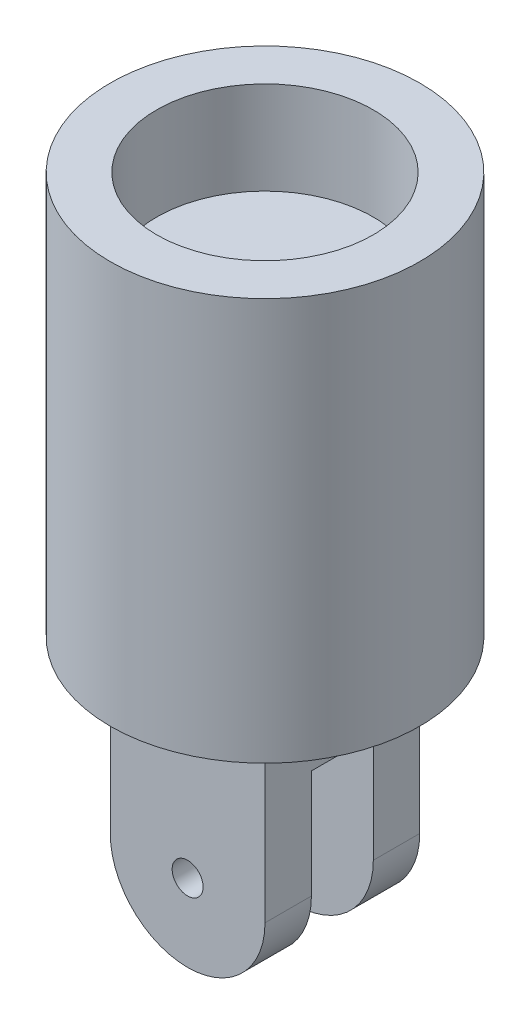
from build123d import *

# Parameters (mm, degrees)
SKETCH1_R           = 5
BOSS_EXTRUDE1_DEPTH = 13
SKETCH2_R           = 3.5
CUT_EXTRUDE1_DEPTH  = 3
SKETCH3_W           = 5
SKETCH3_H           = 5
BOSS_EXTRUDE2_DEPTH = 8
SKETCH4_W           = 5
SKETCH4_H           = 2
CUT_EXTRUDE2_DEPTH  = 6
FILLET2_R           = 2.5
SKETCH5_R           = 0.5
CUT_EXTRUDE4_DEPTH  = 16.81929202


with BuildPart() as part:
    # Sketch1 → Boss-Extrude1 (new body)
    with BuildSketch(Plane(origin=(0, 0, 0), x_dir=(1, 0, 0), z_dir=(0, 1, 0))):
        with Locations(Location((0, 0, 0), (0, 0, 90))):
            Circle(SKETCH1_R)
    extrude(amount=BOSS_EXTRUDE1_DEPTH)

    # Sketch2 → Cut-Extrude1 (cut)
    with BuildSketch(Plane(origin=(0, 13, 0), x_dir=(1, 0, 0), z_dir=(0, 1, 0))):
        with Locations(Location((0, 0, 0), (0, 0, 270))):
            Circle(SKETCH2_R)
    extrude(amount=-CUT_EXTRUDE1_DEPTH, mode=Mode.SUBTRACT)

    # Sketch3 → Boss-Extrude2 (add)
    with BuildSketch(Plane(origin=(0, 0, 0), x_dir=(-1, 0, 0), z_dir=(0, -1, 0))):
        Rectangle(SKETCH3_W, SKETCH3_H)
    extrude(amount=BOSS_EXTRUDE2_DEPTH)

    # Sketch4 → Cut-Extrude2 (cut)
    with BuildSketch(Plane(origin=(0, -8, 0), x_dir=(-1, 0, 0), z_dir=(0, -1, 0))):
        Rectangle(SKETCH4_W, SKETCH4_H)
    extrude(amount=-CUT_EXTRUDE2_DEPTH, mode=Mode.SUBTRACT)

    # Fillet2
    fillet2_edges = [part.edges().sort_by_distance(p)[0] for p in [
        (-2.5, -8, 1.75),
        (2.5, -8, 1.75),
        (2.5, -8, -1.75),
        (-2.5, -8, -1.75),
    ]]
    fillet(fillet2_edges, radius=FILLET2_R - 0.0001)  # a hair under: the kernel refuses the full size

    # Sketch5 → Cut-Extrude4 (cut, through all)
    with BuildSketch(Plane(origin=(0, 0, -2.5), x_dir=(-1, 0, 0), z_dir=(0, 0, -1))):
        with Locations((0, -5.5)):
            Circle(SKETCH5_R)
    extrude(amount=-CUT_EXTRUDE4_DEPTH, mode=Mode.SUBTRACT)


solid = part.part
